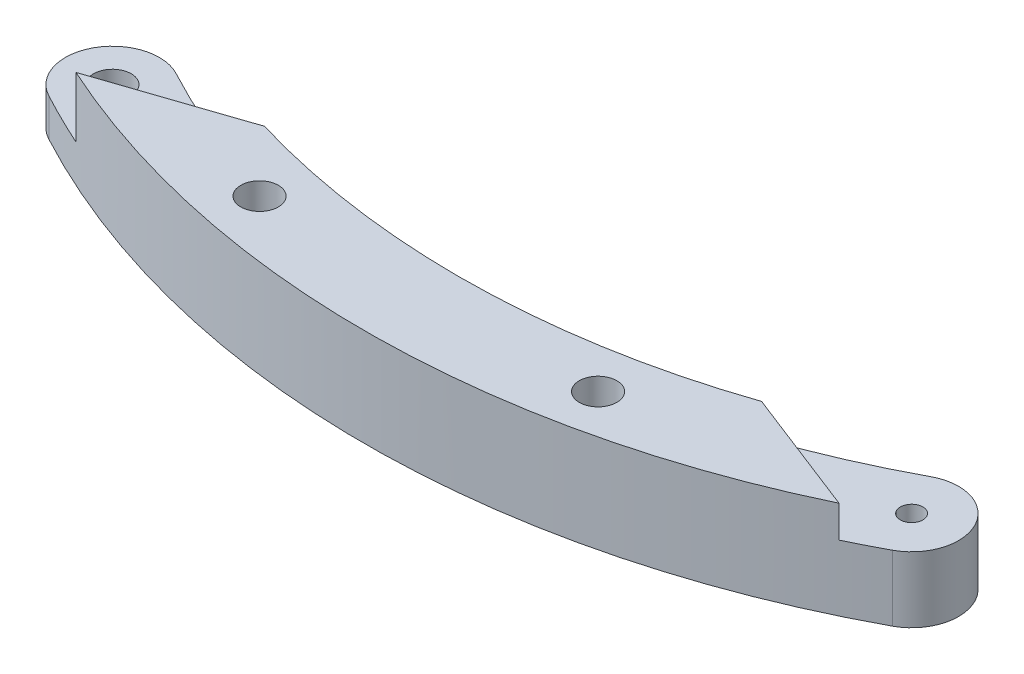
from build123d import *

# Parameters (mm, degrees)
SKETCH2_R           = 1
SKETCH2_R_2         = 0.6
BOSS_EXTRUDE2_DEPTH = 2
BOSS_EXTRUDE3_DEPTH = 3.2
SKETCH4_R           = 0.6
BOSS_EXTRUDE4_DEPTH = 1.5
SKETCH5_R           = 1
CUT_EXTRUDE1_DEPTH  = 46.971757444


with BuildPart() as part:
    # Sketch2 → Boss-Extrude2 (new body)
    with BuildSketch(Plane(origin=(0, 0, 0), x_dir=(1, 0, 0), z_dir=(0, 1, 0))):
        with BuildLine():
            ThreePointArc((43.680555556, 2.203698841), (21.25, 7.833420868), (-1.180555556, 2.203698841))
            ThreePointArc((-1.180555556, 2.203698841), (-2.203698841, -1.180555556), (1.180555556, -2.203698841))
            ThreePointArc((1.180555556, -2.203698841), (21.25, 2.833420868), (41.319444444, -2.203698841))
            ThreePointArc((41.319444444, -2.203698841), (44.703698841, -1.180555556), (43.680555556, 2.203698841))
        make_face()
        Circle(SKETCH2_R, mode=Mode.SUBTRACT)
        with Locations((42.5, 0)):
            Circle(SKETCH2_R_2, mode=Mode.SUBTRACT)
    extrude(amount=BOSS_EXTRUDE2_DEPTH)

    # Sketch3 → Boss-Extrude3 (add)
    with BuildSketch(Plane(origin=(0, 2, 0), x_dir=(1, 0, 0), z_dir=(0, 1, 0))):
        with BuildLine():
            ThreePointArc((41.798567685, 3.158721406), (21.784485497, 7.830413671), (1.670343314, 3.610285866))
            Line((1.670343314, 3.610285866), (9.157651663, 1.076826613))
            ThreePointArc((9.157651663, 1.076826613), (22.148316133, 2.823926021), (35.053533161, 0.529346934))
            Line((35.053533161, 0.529346934), (41.798567685, 3.158721406))
        make_face()
    extrude(amount=BOSS_EXTRUDE3_DEPTH)

    # Sketch4 → Boss-Extrude4 (add)
    with BuildSketch(Plane(origin=(0, 2, 0), x_dir=(1, 0, 0), z_dir=(0, 1, 0))):
        with BuildLine():
            ThreePointArc((43.680555556, 2.203698841), (42.744866263, 2.691663565), (41.798567685, 3.158721406))
            Line((41.798567685, 3.158721406), (35.053533161, 0.529346934))
            ThreePointArc((35.053533161, 0.529346934), (38.241528412, -0.710989517), (41.319444444, -2.203698841))
            ThreePointArc((41.319444444, -2.203698841), (44.703698841, -1.180555556), (43.680555556, 2.203698841))
        make_face()
        with Locations((42.5, 0)):
            Circle(SKETCH4_R, mode=Mode.SUBTRACT)
    extrude(amount=BOSS_EXTRUDE4_DEPTH)

    # Sketch5 → Cut-Extrude1 (cut, through all)
    with BuildSketch(Plane(origin=(0, 5.2, 0), x_dir=(1, 0, 0), z_dir=(0, 1, 0))):
        with Locations((12.25, 4.424236239)):
            Circle(SKETCH5_R)
        with Locations((30.25, 4.424236239)):
            Circle(SKETCH5_R)
    extrude(amount=-CUT_EXTRUDE1_DEPTH, mode=Mode.SUBTRACT)


with BuildPart() as body_2:
    # Mirror2: mirrored copy
    add(part.part.mirror(Plane.XY))


solid = body_2.part
